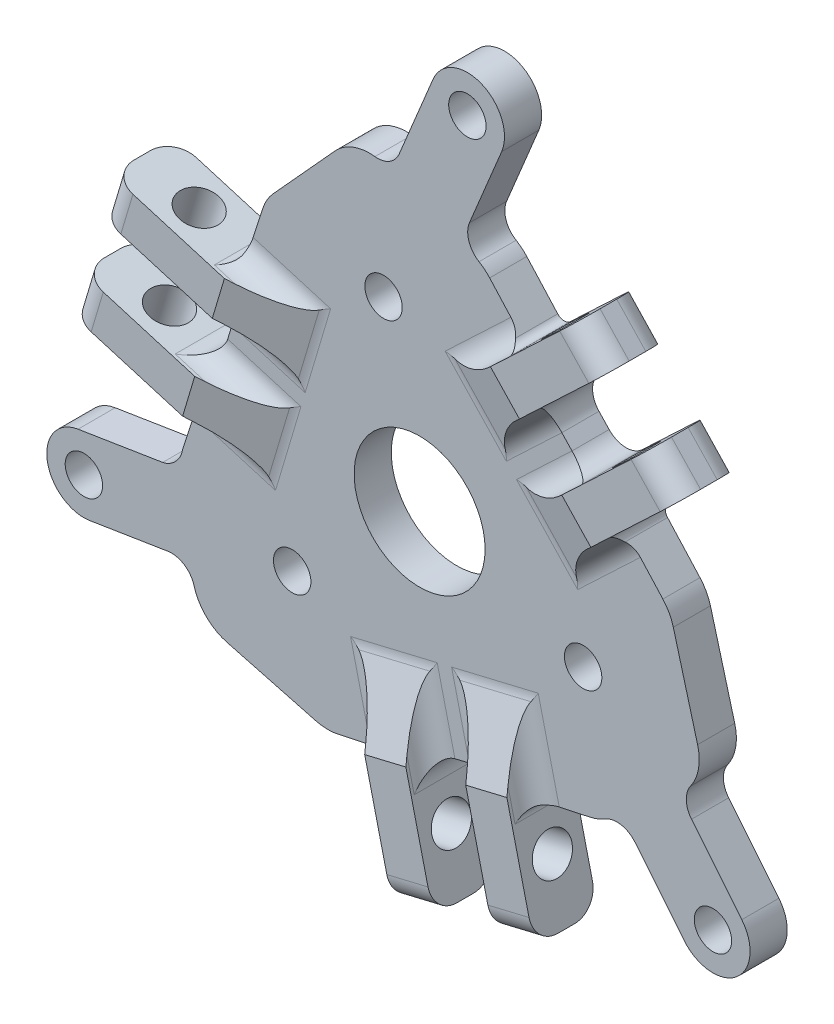
from build123d import *

# Parameters (mm, degrees)
SKETCH1_R                = 1.6
SKETCH1_R_2              = 5.6
BOSS_EXTRUDE1_DEPTH      = 3.175
SKETCH4_R                = 1.675
BOSS_EXTRUDE3_DEPTH      = 6.25
SKETCH4_2_R              = 1.675
CUT_EXTRUDE2_DEPTH       = 2.63125
FILLET1_R                = 2
FILLET2_R                = 2
FILLET3_R                = 2
CIRPATTERN2_COUNT        = 3
FILLET1_OF_CIRPATTERN2_R = 2
FILLET2_OF_CIRPATTERN2_R = 2
FILLET3_OF_CIRPATTERN2_R = 2
FILLET5_R                = 0.75
SKETCH6_R                = 1.6
BOSS_EXTRUDE4_DEPTH      = 3.175
FILLET6_R                = 2
FILLET7_DEPTH            = 3.175


with BuildPart() as part:
    # Sketch1 → Boss-Extrude1 (new body)
    with BuildSketch(Plane.XY):
        with BuildLine():
            Line((15.347308801, 31.210973101), (8.051491314, 33.998880179))
            ThreePointArc((8.051491314, 33.998880179), (5.696175566, 34.15336703), (3.663829908, 32.952971436))
            Line((3.663829908, 32.952971436), (-1.653149933, 27.103867562))
            ThreePointArc((-1.653149933, 27.103867562), (-2.154824203, 26.417727613), (-2.500196213, 25.641078866))
            Line((-2.500196213, 25.641078866), (-9.325438013, 4.478720632))
            ThreePointArc((-9.325438013, 4.478720632), (-9.502063256, 3.613546149), (-9.484560317, 2.730700176))
            Line((-9.484560317, 2.730700176), (-8.507421128, -4.718687488))
            ThreePointArc((-8.507421128, -4.718687488), (-7.54564448, -6.839386894), (-5.565731281, -8.065080174))
            Line((-5.565731281, -8.065080174), (2.031002829, -10.077591551))
            ThreePointArc((2.031002829, -10.077591551), (2.960636861, -10.209852347), (3.895489669, -10.121746843))
            Line((3.895489669, -10.121746843), (25.485057009, -5.483666514))
            ThreePointArc((25.485057009, -5.483666514), (26.373611638, -5.180049941), (27.166902489, -4.677653705))
            Line((27.166902489, -4.677653705), (33.329625608, 0.328323939))
            ThreePointArc((33.329625608, 0.328323939), (34.614533997, 2.205289229), (34.668387555, 4.479291881))
            Line((34.668387555, 4.479291881), (32.591741985, 12.142614371))
            ThreePointArc((32.591741985, 12.142614371), (32.241466178, 13.013831458), (31.697738169, 13.779384986))
            Line((31.697738169, 13.779384986), (16.88625911, 30.157458595))
            ThreePointArc((16.88625911, 30.157458595), (16.17904213, 30.77516119), (15.347308801, 31.210973101))
        make_face()
        with Locations((24.879793107, 5.344918551)):
            Circle(SKETCH1_R, mode=Mode.SUBTRACT)
        with Locations((7.811061307, 24.218992148)):
            Circle(SKETCH1_R, mode=Mode.SUBTRACT)
        Circle(SKETCH1_R, mode=Mode.SUBTRACT)
        with Locations((10.896951472, 9.8546369)):
            Circle(SKETCH1_R_2, mode=Mode.SUBTRACT)
    extrude(amount=BOSS_EXTRUDE1_DEPTH)

    # Sketch4 → Boss-Extrude3 (add, symmetric)
    with BuildSketch(Plane(origin=(0.449621982, -0.475334512, 0), x_dir=(-0.7264827405282465, -0.6871847114965295, 0), z_dir=(0.6871847114965295, -0.7264827405282465, 0))):
        Polygon((-31.72132028, 0), (-31.72132028, -3.175), (-25.539496086, -3.175), (-31.72132028, -5.425), (-41.88132028, -5.425), (-41.88132028, 0), align=None)
        with Locations(Location((-36.80132028, -2.7125, 0), (0, 0, 180))):
            Circle(SKETCH4_R, mode=Mode.SUBTRACT)
    boss_extrude3 = extrude(amount=BOSS_EXTRUDE3_DEPTH, both=True)

    # Sketch4<2> → Cut-Extrude2 (cut, symmetric)
    with BuildSketch(Plane(origin=(0.449621982, -0.475334512, 0), x_dir=(-0.7264827405282465, -0.6871847114965295, 0), z_dir=(0.6871847114965295, -0.7264827405282465, 0))):
        Polygon((-31.72132028, 0), (-31.72132028, -3.175), (-25.539496086, -3.175), (-31.72132028, -5.425), (-41.88132028, -5.425), (-41.88132028, 0), align=None)
        with Locations(Location((-36.80132028, -2.7125, 0), (0, 0, 180))):
            Circle(SKETCH4_2_R, mode=Mode.SUBTRACT)
    cut_extrude2 = extrude(amount=CUT_EXTRUDE2_DEPTH, both=True, mode=Mode.SUBTRACT)

    # Fillet1
    fillet1_edges = [part.edges().sort_by_distance(p)[0] for p in [
        (19.440964609, 21.110601986, 3.175),
        (23.057274153, 17.287486564, 3.175),
        (25.865326768, 14.96244967, 3.175),
        (17.377217607, 24.139682361, 3.175),
        (22.0551547, 13.848979318, 3.175),
        (15.952095481, 20.301054157, 3.175),
    ]]
    fillet(fillet1_edges, radius=FILLET1_R)

    # Fillet2
    fillet2_edges = [part.edges().sort_by_distance(p)[0] for p in [
        (25.302768444, 19.411514101, 2.5875),
        (21.6864589, 23.234629523, 2.5875),
    ]]
    fillet(fillet2_edges, radius=FILLET2_R)

    # Fillet3
    fillet3_edges = [part.edges().sort_by_distance(p)[0] for p in [
        (33.927207925, 25.078831062, 0),
        (33.927207925, 25.078831062, 5.425),
        (27.824148706, 31.530905901, 5.425),
        (27.824148706, 31.530905901, 0),
    ]]
    fillet(fillet3_edges, radius=FILLET3_R)

    # CirPattern2: Boss-Extrude3, Cut-Extrude2 ×3 about axis
    cirpattern2_axis = Axis((10.896951472, 9.8546369, 0), (0, 0, 1))
    add([boss_extrude3.rotate(cirpattern2_axis, i * 360 / CIRPATTERN2_COUNT) for i in range(1, CIRPATTERN2_COUNT)])
    add([cut_extrude2.rotate(cirpattern2_axis, i * 360 / CIRPATTERN2_COUNT) for i in range(1, CIRPATTERN2_COUNT)], mode=Mode.SUBTRACT)

    # Fillet1 of CirPattern2
    fillet1_of_cirpattern2_edges = [part.edges().sort_by_distance(p)[0] for p in [
        (-3.123006806, 11.625986784, 3.175),
        (-1.620246501, 16.669360428, 3.175),
        (-1.010731793, 20.263723774, 3.175),
        (-4.71439386, 8.324189266, 3.175),
        (1.858647852, 17.520753147, 3.175),
        (-0.677483256, 9.009311403, 3.175),
        (16.372896612, -3.172678071, 3.175),
        (11.253826762, -4.392936293, 3.175),
        (7.836259441, -5.662262745, 3.175),
        (20.028030667, -2.899960928, 3.175),
        (8.777051863, -1.805821766, 3.175),
        (17.41624219, 0.253545139, 3.175),
    ]]
    fillet(fillet1_of_cirpattern2_edges, radius=FILLET1_OF_CIRPATTERN2_R)

    # Fillet2 of CirPattern2
    fillet2_of_cirpattern2_edges = [part.edges().sort_by_distance(p)[0] for p in [
        (-4.582455452, 17.552001759, 2.5875),
        (-6.085215757, 12.508628115, 2.5875),
        (11.970541423, -7.399605162, 2.5875),
        (17.089611272, -6.17934694, 2.5875),
    ]]
    fillet(fillet2_of_cirpattern2_edges, radius=FILLET2_OF_CIRPATTERN2_R)

    # Fillet3 of CirPattern2
    fillet3_of_cirpattern2_edges = [part.edges().sort_by_distance(p)[0] for p in [
        (-13.802715652, 22.187326963, 0),
        (-13.802715652, 22.187326963, 5.425),
        (-16.33884676, 13.675885219, 5.425),
        (-16.33884676, 13.675885219, 0),
        (12.566362141, -17.702247326, 0),
        (12.566362141, -17.702247326, 5.425),
        (21.205552469, -15.642880421, 5.425),
        (21.205552469, -15.642880421, 0),
    ]]
    fillet(fillet3_of_cirpattern2_edges, radius=FILLET3_OF_CIRPATTERN2_R)

    # Fillet5
    fillet5_edges = [part.edges().sort_by_distance(p)[0] for p in [
        (28.432123998, 17.390399731, 2.5875),
        (20.045714571, 26.663830856, 2.5875),
        (-3.951849266, 21.140080535, 2.5875),
        (-7.789671487, 9.240521362, 2.5875),
        (20.879758905, -6.473021336, 2.5875),
        (8.655527257, -9.099149384, 2.5875),
    ]]
    fillet(fillet5_edges, radius=FILLET5_R)

    # Sketch6 → Boss-Extrude4 (add)
    # profile 1 of 3: a face of its own
    with BuildSketch(Plane.XY.offset(3.175)):
        with BuildLine():
            Line((33.025876707, 0.081588823), (38.446777266, -6.591934627))
            ThreePointArc((38.446777266, -6.591934627), (37.98420777, -11.058172357), (33.51797004, -10.595602861))
            Line((33.51797004, -10.595602861), (28.097069481, -3.922079411))
            Line((28.097069481, -3.922079411), (33.025876707, 0.081588823))
        make_face()
        with Locations((35.982373653, -8.593768744)):
            Circle(SKETCH6_R, mode=Mode.SUBTRACT)
    # profile 2 of 3: a face of its own
    with BuildSketch(Plane.XY.offset(3.175)):
        with BuildLine():
            Line((17.914724354, 40.027335148), (14.407003583, 31.570286308))
            Line((14.407003583, 31.570286308), (8.472967038, 33.837824182))
            Line((8.472967038, 33.837824182), (12.0492416, 42.460154926))
            ThreePointArc((12.0492416, 42.460154926), (16.198392866, 44.176486414), (17.914724354, 40.027335148))
        make_face()
        with Locations((14.981982977, 41.243745037)):
            Circle(SKETCH6_R, mode=Mode.SUBTRACT)
    # profile 3 of 3: a face of its own
    with BuildSketch(Plane.XY.offset(3.175)):
        with BuildLine():
            Line((-18.312481345, 1.356439354), (-9.489401214, 2.76760558))
            Line((-9.489401214, 2.76760558), (-8.66321575, -3.530960551))
            Line((-8.66321575, -3.530960551), (-17.309606559, -4.913867031))
            ThreePointArc((-17.309606559, -4.913867031), (-20.946197145, -2.280151231), (-18.312481345, 1.356439354))
        make_face()
        with Locations((-17.811043952, -1.778713838)):
            Circle(SKETCH6_R, mode=Mode.SUBTRACT)
    extrude(amount=-BOSS_EXTRUDE4_DEPTH)

    # Fillet6
    fillet6_edges = [part.edges().sort_by_distance(p)[0] for p in [
        (8.472967038, 33.837824182, 1.5875),
        (14.407003583, 31.570286308, 1.5875),
        (33.025876707, 0.081588823, 1.5875),
        (28.097069481, -3.922079411, 1.5875),
        (-8.66321575, -3.530960551, 1.5875),
    ]]
    fillet(fillet6_edges, radius=FILLET6_R)

    # Fillet7: read off the stored shape, not the designer's step
    # Fillet7 outline → Fillet7 (add)
    with BuildSketch(Plane.XY):
        with BuildLine():
            add(Edge.make_bspline(
                [(-11.073512724, 2.514242285), (-9.716115967, 2.731344751), (-9.432430494, 4.076403111)],
                knots=[0, 0, 0, 1, 1, 1], degree=2, weights=[1, 0.648905094, 1]))
            Line((-11.073512724, 2.514242285), (-9.489401214, 2.76760558))
            Line((-9.489401214, 2.76760558), (-9.484560317, 2.730700176))
            ThreePointArc((-9.484560317, 2.730700176), (-9.515535997, 3.405761281), (-9.432430494, 4.076403111))
        make_face()
    extrude(amount=FILLET7_DEPTH)


solid = part.part
